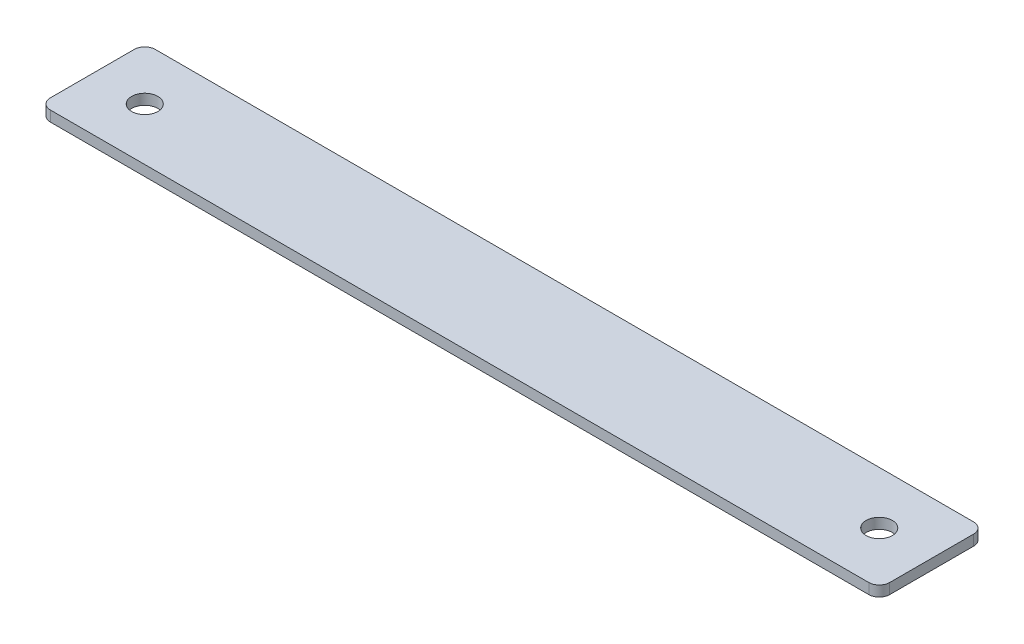
from build123d import *

# Parameters (mm, degrees)
SKETCH_1_R             = 2.5
SM_BASE_FLANGE_1_DEPTH = 2


# Sheet-metal steps are written as plain solids
with BuildPart() as part:
    # Sketch 1 → 基体-法兰1 (new body)
    with BuildSketch(Plane(origin=(0, 0, 0), x_dir=(1, 0, 0), z_dir=(0, 1, 0))):
        with BuildLine():
            Line((-78, 10), (78, 10))
            ThreePointArc((78, 10), (79.414213562, 9.414213562), (80, 8))
            Line((80, 8), (80, -8))
            ThreePointArc((80, -8), (79.414213562, -9.414213562), (78, -10))
            Line((78, -10), (-78, -10))
            ThreePointArc((-78, -10), (-79.414213562, -9.414213562), (-80, -8))
            Line((-80, -8), (-80, 8))
            ThreePointArc((-80, 8), (-79.414213562, 9.414213562), (-78, 10))
        make_face()
        with Locations(Location((-70, 0, 0), (0, 0, 270))):
            Circle(SKETCH_1_R, mode=Mode.SUBTRACT)
        with Locations(Location((70, 0, 0), (0, 0, 270))):
            Circle(SKETCH_1_R, mode=Mode.SUBTRACT)
    extrude(amount=-SM_BASE_FLANGE_1_DEPTH)


solid = part.part
